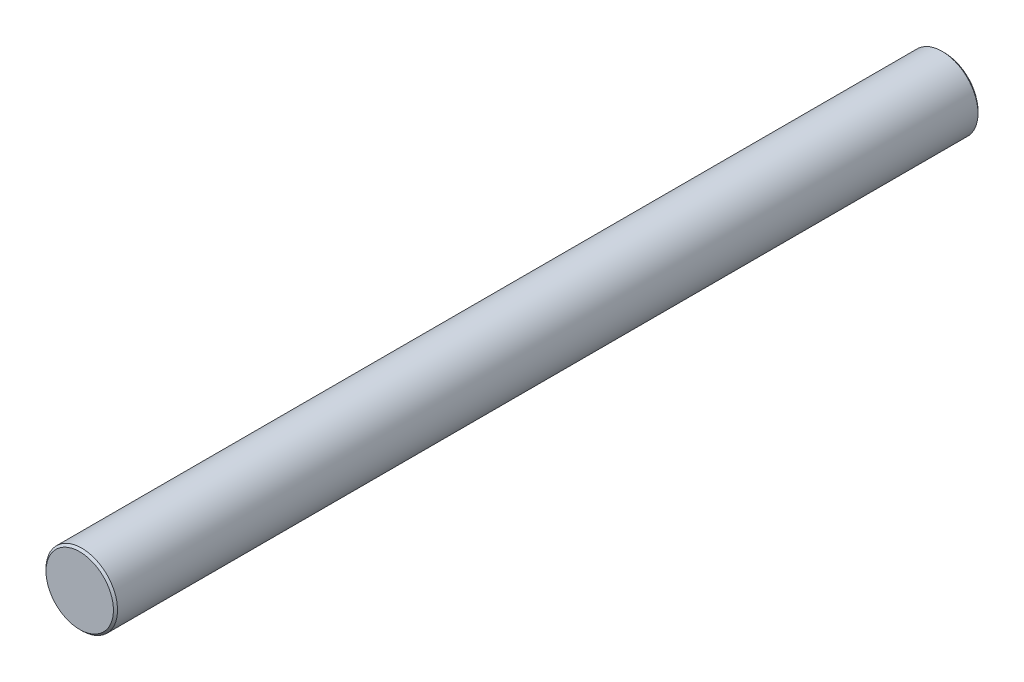
from build123d import *

# Parameters (mm, degrees)
SKETCH1_R           = 3.475
BOSS_EXTRUDE1_DEPTH = 42
CHAMFER1_SIZE       = 0.2


with BuildPart() as part:
    # Sketch1 → Boss-Extrude1 (new, symmetric)
    with BuildSketch(Plane.XY):
        Circle(SKETCH1_R)
    extrude(amount=BOSS_EXTRUDE1_DEPTH, both=True)

    # Chamfer1
    chamfer1_edges = [part.edges().sort_by_distance(p)[0] for p in [
        (-3.475, 0, -42),
        (-3.475, 0, 42),
    ]]
    chamfer(chamfer1_edges, length=CHAMFER1_SIZE)


solid = part.part
